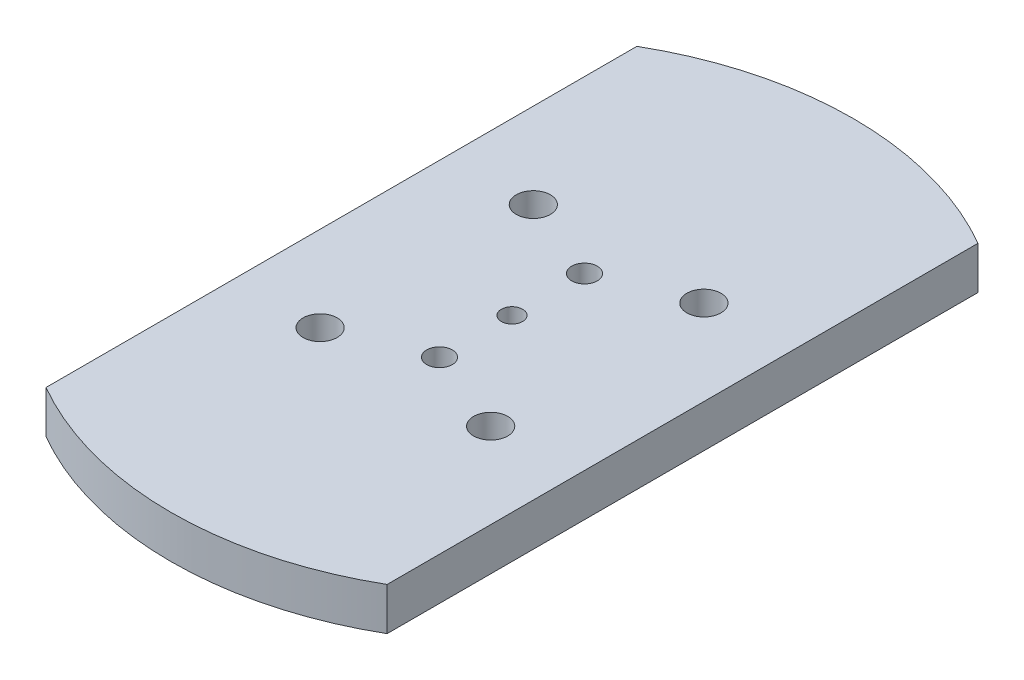
from build123d import *

# Parameters (mm, degrees)
ESQUISSE1_W               = 40
ESQUISSE1_H               = 80
BOSS_EXTRU_1_DEPTH        = 5
ESQUISSE2_R               = 1.5
ENL_V_MAT_EXTRU_1_DEPTH   = 5
ENL_V_START               = -5
ENL_V_MAT_EXTRU_5_DEPTH   = 5
ESQUISSE13_R              = 2
ENL_V_MAT_EXTRU_9_DEPTH   = 5
SYM_TRIE6_COPY_1_SKETCH_R = 2
SYM_TRIE6_COPY_1_DEPTH    = 5
ESQUISSE15_R              = 1.25
ENL_V_MAT_EXTRU_10_DEPTH  = 10


# Read off the part's stored shape, not the designer's step: Enlèv. mat.-Extru.5
with BuildPart() as part:
    # Esquisse1 → Boss.-Extru.1 (new body)
    with BuildSketch(Plane(origin=(0, 0, 0), x_dir=(1, 0, 0), z_dir=(0, 1, 0))):
        Rectangle(ESQUISSE1_W, ESQUISSE1_H)
    extrude(amount=BOSS_EXTRU_1_DEPTH)

    # Esquisse2 → Enlèv. mat.-Extru.1 (cut)
    with BuildSketch(Plane(origin=(0, 5, 0), x_dir=(1, 0, 0), z_dir=(0, 1, 0))):
        with Locations(Location((0, 8.5, 0), (0, 0, 270))):
            Circle(ESQUISSE2_R)
        with Locations(Location((0, -8.5, 0), (0, 0, 270))):
            Circle(ESQUISSE2_R)
    extrude(amount=-ENL_V_MAT_EXTRU_1_DEPTH, mode=Mode.SUBTRACT)

    # Enlèv. mat.-Extru.5 outline → Enlèv. mat.-Extru.5 (cut)
    with BuildSketch(Plane(origin=(0, 0, 0), x_dir=(-1, 0, 0), z_dir=(0, -1, 0)).offset(ENL_V_START)):
        with BuildLine():
            ThreePointArc((0, -40), (-10.352761804, -38.637033051), (-20, -34.641016151))
            Line((-20, -34.641016151), (-20, -40))
            Line((-20, -40), (0, -40))
        make_face()
        with BuildLine():
            ThreePointArc((20, -34.641016151), (10.352761804, -38.637033051), (0, -40))
            Line((0, -40), (20, -40))
            Line((20, -40), (20, -34.641016151))
        make_face()
        with BuildLine():
            Line((-20, 40), (-20, 34.641016151))
            ThreePointArc((-20, 34.641016151), (-10.352761804, 38.637033051), (0, 40))
            Line((0, 40), (-20, 40))
        make_face()
        with BuildLine():
            Line((20, 40), (0, 40))
            ThreePointArc((0, 40), (10.352761804, 38.637033051), (20, 34.641016151))
            Line((20, 34.641016151), (20, 40))
        make_face()
    extrude(amount=ENL_V_MAT_EXTRU_5_DEPTH, mode=Mode.SUBTRACT)

    # Esquisse13 → Enlèv. mat.-Extru.9 (cut)
    with BuildSketch(Plane(origin=(0, 5, 0), x_dir=(1, 0, 0), z_dir=(0, 1, 0))):
        with Locations(Location((-10, 12.5, 0), (0, 0, 270))):
            Circle(ESQUISSE13_R)
    enl_v_mat_extru_9 = extrude(amount=-ENL_V_MAT_EXTRU_9_DEPTH, mode=Mode.SUBTRACT)

    # Symétrie5: Enlèv. mat.-Extru.9 across plane
    add(enl_v_mat_extru_9.mirror(Plane(origin=(0, 0, 0), x_dir=(0, 0, 1), z_dir=(1, 0, 0))), mode=Mode.SUBTRACT)

    # Symétrie6: Enlèv. mat.-Extru.9 across plane
    add(enl_v_mat_extru_9.mirror(Plane.XY), mode=Mode.SUBTRACT)

    # Symétrie6 copy 1 sketch → Symétrie6 copy 1 (cut)
    with BuildSketch(Plane(origin=(0, 5, 0), x_dir=(-1, 0, 0), z_dir=(0, 1, 0))):
        with Locations(Location((-10, 12.5, 0), (0, 0, 270))):
            Circle(SYM_TRIE6_COPY_1_SKETCH_R)
    extrude(amount=-SYM_TRIE6_COPY_1_DEPTH, mode=Mode.SUBTRACT)

    # Esquisse15 → Enlèv. mat.-Extru.10 (cut)
    with BuildSketch(Plane(origin=(0, 5, 0), x_dir=(1, 0, 0), z_dir=(0, 1, 0))):
        with Locations(Location((0, 0, 0), (0, 0, 270))):
            Circle(ESQUISSE15_R)
    extrude(amount=-ENL_V_MAT_EXTRU_10_DEPTH, mode=Mode.SUBTRACT)


solid = part.part
